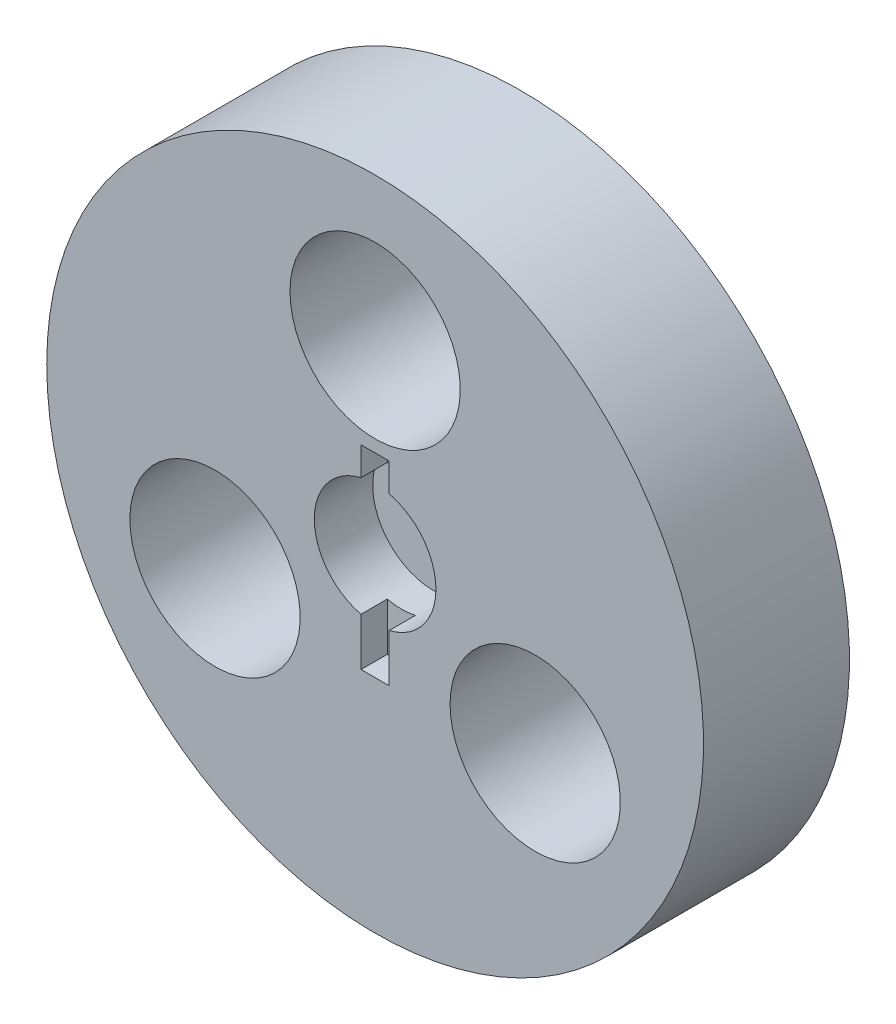
from build123d import *

# Parameters (mm, degrees)
SKETCH1_R           = 42.8625
SKETCH1_R_2         = 11.1125
BOSS_EXTRUDE1_DEPTH = 9.525
SKETCH2_R           = 7.9375
CUT_EXTRUDE1_DEPTH  = 7.62
SKETCH3_W           = 3.683
SKETCH3_H           = 25.4
CUT_EXTRUDE2_DEPTH  = 3.429


with BuildPart() as part:
    # Sketch1 → Boss-Extrude1 (new, symmetric)
    with BuildSketch(Plane.XY):
        Circle(SKETCH1_R)
        with Locations((-20.897192993, -12.065)):
            Circle(SKETCH1_R_2, mode=Mode.SUBTRACT)
        with Locations((20.897192993, -12.065)):
            Circle(SKETCH1_R_2, mode=Mode.SUBTRACT)
        with BuildLine():
            ThreePointArc((0, 13.0175), (-7.857724106, 31.987724106), (11.1125, 24.13))
            ThreePointArc((11.1125, 24.13), (7.857724106, 16.272275894), (0, 13.0175))
        make_face(mode=Mode.SUBTRACT)
    extrude(amount=BOSS_EXTRUDE1_DEPTH, both=True)

    # Sketch2 → Cut-Extrude1 (cut)
    with BuildSketch(Plane.XY.offset(9.525)):
        Circle(SKETCH2_R)
    extrude(amount=-CUT_EXTRUDE1_DEPTH, mode=Mode.SUBTRACT)

    # Sketch3 → Cut-Extrude2 (cut)
    with BuildSketch(Plane.XY.offset(9.525)):
        with Locations((0, -1.27)):
            Rectangle(SKETCH3_W, SKETCH3_H)
    extrude(amount=-CUT_EXTRUDE2_DEPTH, mode=Mode.SUBTRACT)


solid = part.part
